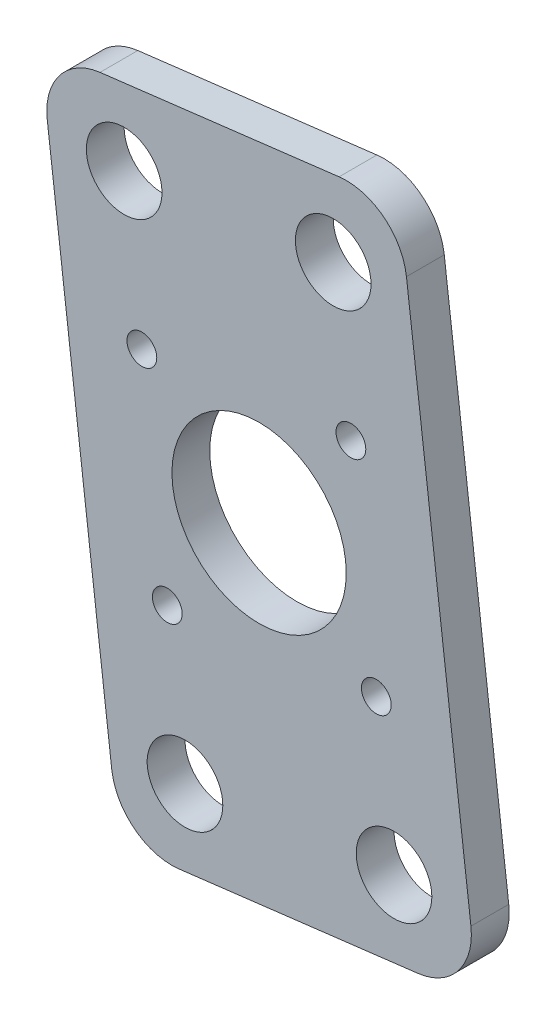
from build123d import *

# Parameters (mm, degrees)
SKETCH1_R           = 3.175
SKETCH1_R_2         = 7.317167392
BOSS_EXTRUDE2_DEPTH = 3.175


with BuildPart() as part:
    # Sketch1 → Boss-Extrude2 (new body)
    with BuildSketch(Plane.XY):
        with BuildLine():
            ThreePointArc((-103.75515137, -130.108023512), (-107.141377815, -132.018654189), (-108.18478159, -135.764097779))
            Line((-108.18478159, -135.764097779), (-102.771631061, -180.279325978))
            ThreePointArc((-102.771631061, -180.279325978), (-100.861000384, -183.665552424), (-97.115556794, -184.708956198))
            Line((-97.115556794, -184.708956198), (-77.045729993, -182.268420724))
            ThreePointArc((-77.045729993, -182.268420724), (-73.659503547, -180.357790047), (-72.616099773, -176.612346457))
            Line((-72.616099773, -176.612346457), (-78.029250302, -132.097118258))
            ThreePointArc((-78.029250302, -132.097118258), (-79.939880979, -128.710891812), (-83.685324569, -127.667488038))
            Line((-83.685324569, -127.667488038), (-103.75515137, -130.108023512))
        make_face()
        with Locations((-96.621371262, -178.252085388)):
            Circle(SKETCH1_R, mode=Mode.SUBTRACT)
        with BuildLine():
            ThreePointArc((-99.091795046, -165.258660878), (-97.336954979, -165.045268432), (-97.123562532, -166.8001085))
            ThreePointArc((-97.123562532, -166.8001085), (-98.8784026, -167.013500946), (-99.091795046, -165.258660878))
        make_face(mode=Mode.SUBTRACT)
        with Locations((-90.400440681, -156.188222118)):
            Circle(SKETCH1_R_2, mode=Mode.SUBTRACT)
        with Locations((-79.072970583, -176.118160925)):
            Circle(SKETCH1_R, mode=Mode.SUBTRACT)
        with BuildLine():
            ThreePointArc((-79.575161853, -164.666184037), (-81.330001921, -164.879576483), (-81.543394368, -163.124736415))
            ThreePointArc((-81.543394368, -163.124736415), (-79.7885543, -162.911343969), (-79.575161853, -164.666184037))
        make_face(mode=Mode.SUBTRACT)
        with BuildLine():
            ThreePointArc((-99.257486995, -149.251707821), (-101.012327063, -149.465100267), (-101.225719509, -147.710260199))
            ThreePointArc((-101.225719509, -147.710260199), (-99.470879442, -147.496867753), (-99.257486995, -149.251707821))
        make_face(mode=Mode.SUBTRACT)
        with Locations((-101.72791078, -136.258283311)):
            Circle(SKETCH1_R, mode=Mode.SUBTRACT)
        with BuildLine():
            ThreePointArc((-83.677318831, -145.576335736), (-81.922478763, -145.36294329), (-81.709086316, -147.117783358))
            ThreePointArc((-81.709086316, -147.117783358), (-83.463926384, -147.331175804), (-83.677318831, -145.576335736))
        make_face(mode=Mode.SUBTRACT)
        with Locations((-84.179510101, -134.124358848)):
            Circle(SKETCH1_R, mode=Mode.SUBTRACT)
    extrude(amount=BOSS_EXTRUDE2_DEPTH)


solid = part.part
